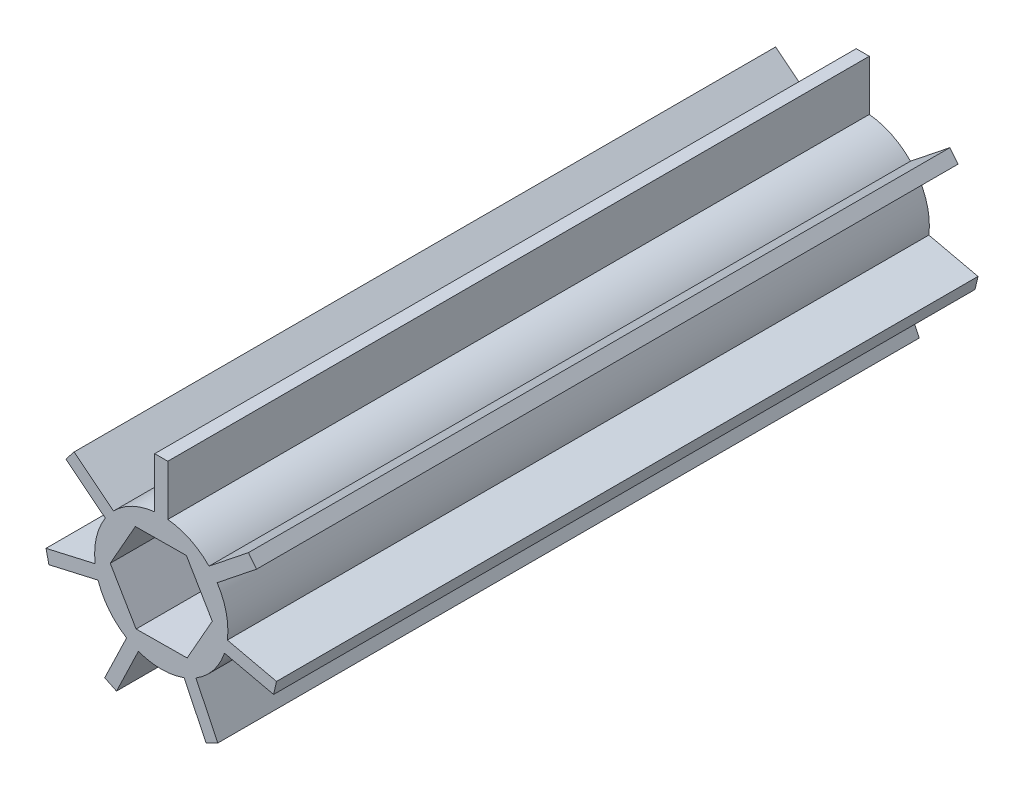
from build123d import *

# Parameters (mm, degrees)
BOSS_EXTRUDE1_DEPTH = 76.2
SKETCH6_R           = 7.239
BOSS_EXTRUDE2_DEPTH = 76.2
CIRPATTERN1_COUNT   = 7
CUT_EXTRUDE5_DEPTH  = 79.255893748


with BuildPart() as part:
    # Sketch12 → Boss-Extrude1 (new body)
    with BuildSketch(Plane.XY):
        Polygon((0, 0), (0.7112, 0), (0.7112, 12.680070763), (-0.7112, 12.680070763), (-0.7112, 0), align=None)
    boss_extrude1 = extrude(amount=-BOSS_EXTRUDE1_DEPTH)

    # Sketch6 → Boss-Extrude2 (add)
    with BuildSketch(Plane.XY):
        Circle(SKETCH6_R)
    extrude(amount=-BOSS_EXTRUDE2_DEPTH)

    # CirPattern1: Boss-Extrude1 ×7 about axis
    cirpattern1_axis = Axis((0, 0, -76.2), (0, 0, 1))
    for i in range(1, CIRPATTERN1_COUNT):
        add(boss_extrude1.rotate(cirpattern1_axis, i * 360 / CIRPATTERN1_COUNT))

    # Sketch8 → Cut-Extrude5 (cut, through all)
    with BuildSketch(Plane.XY):
        Polygon((5.543055098, 0.047123876), (2.730717076, 4.823988467), (-2.812338023, 4.776864592), (-5.543055098, -0.047123876), (-2.730717076, -4.823988467), (2.812338023, -4.776864592), align=None)
    extrude(amount=-CUT_EXTRUDE5_DEPTH, mode=Mode.SUBTRACT)


solid = part.part
